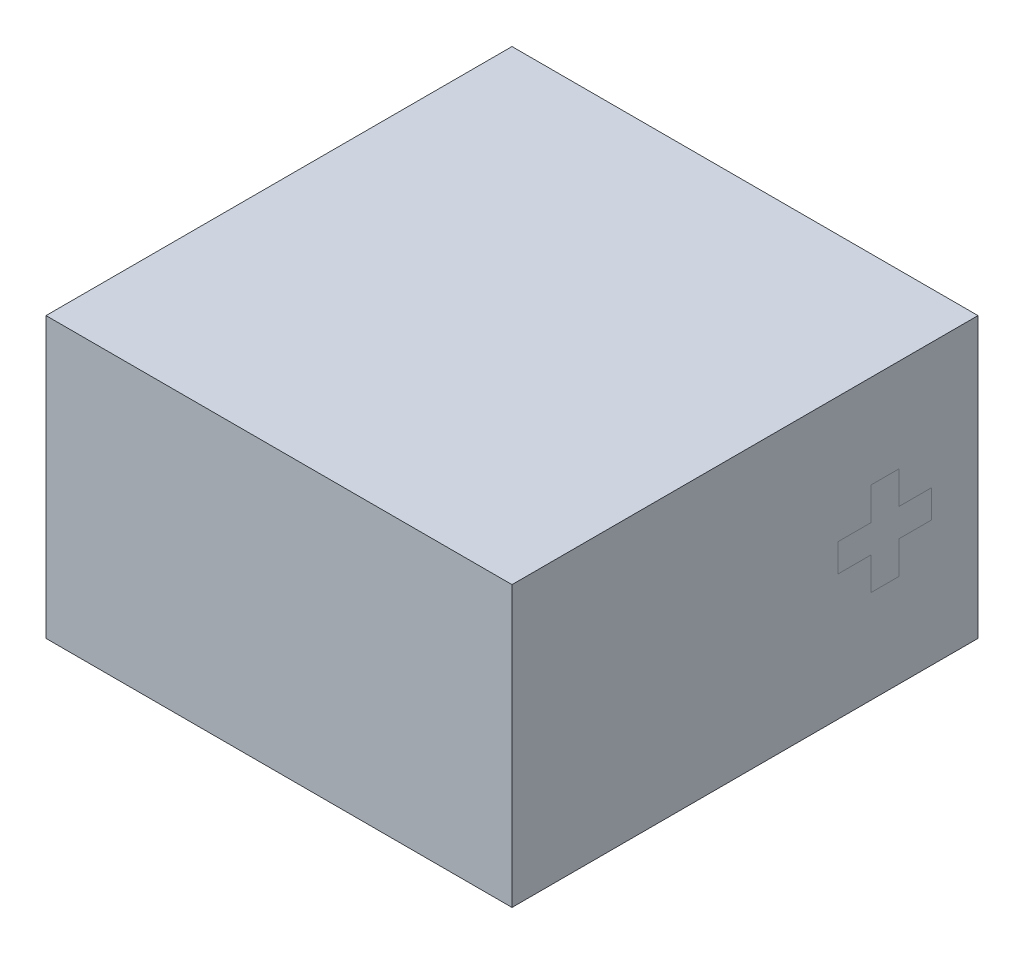
from build123d import *

# Parameters (mm, degrees)
SKETCH1_W           = 5
SKETCH1_H           = 5
BOSS_EXTRUDE1_DEPTH = 3


with BuildPart() as part:
    # Sketch1 → Boss-Extrude1 (new body)
    with BuildSketch(Plane(origin=(0, 0, 0), x_dir=(1, 0, 0), z_dir=(0, 1, 0))):
        Rectangle(SKETCH1_W, SKETCH1_H)
    extrude(amount=BOSS_EXTRUDE1_DEPTH)


solid = part.part
